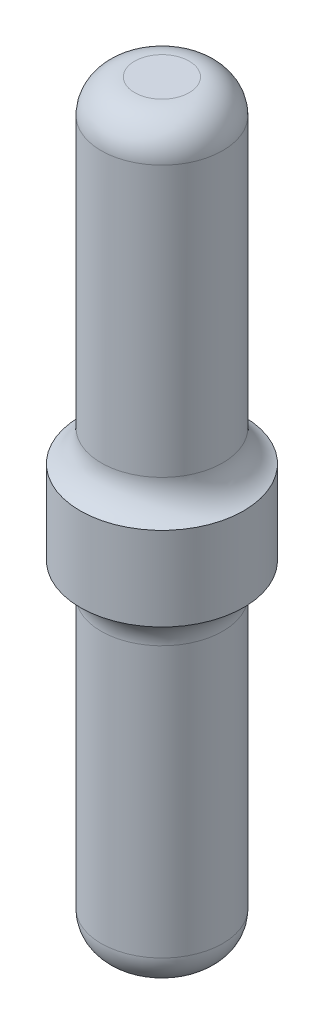
from build123d import *

# Parameters (mm, degrees)
CROQUIS1_R              = 2.44
SALIENTE_EXTRUIR1_DEPTH = 2.5
CROQUIS2_R              = 1.815
SALIENTE_EXTRUIR2_DEPTH = 10
SALIENTE_EXTRUIR3_START = 10
CROQUIS3_R              = 1.815
SALIENTE_EXTRUIR3_DEPTH = 10
REDONDEO1_R             = 1
REDONDEO2_R             = 1


with BuildPart() as part:
    # Croquis1 → Saliente-Extruir1 (new body)
    with BuildSketch(Plane(origin=(0, 0, 0), x_dir=(1, 0, 0), z_dir=(0, 1, 0))):
        with Locations(Location((0, 0, 0), (0, 0, 270))):
            Circle(CROQUIS1_R)
    extrude(amount=SALIENTE_EXTRUIR1_DEPTH)

    # Croquis2 → Saliente-Extruir2 (add)
    with BuildSketch(Plane(origin=(0, 2.5, 0), x_dir=(1, 0, 0), z_dir=(0, 1, 0))):
        with Locations(Location((0, 0, 0), (0, 0, 270))):
            Circle(CROQUIS2_R)
    extrude(amount=SALIENTE_EXTRUIR2_DEPTH)

    # Croquis3 → Saliente-Extruir3 (add)
    with BuildSketch(Plane.XZ.offset(SALIENTE_EXTRUIR3_START)):
        with Locations(Location((0, 0, 0), (0, 0, 90))):
            Circle(CROQUIS3_R)
    extrude(amount=-SALIENTE_EXTRUIR3_DEPTH)

    # Redondeo1
    # the kernel refuses this fillet: 1 mm, written as the material it adds along each edge
    with BuildSketch(Plane(origin=(0, 0, 0), x_dir=(0, 0, 1), z_dir=(1, 0, 0))) as redondeo1_piece_1:
        with BuildLine():
            CenterArc((2.815, 0.927024811), REDONDEO1_R, 180, 67.975687163)
            Line((1.815, 0.927024811), (1.795, 0.927024811))
            Line((1.795, 0.927024811), (1.795, 0))
            Line((1.795, 0), (1.815, -0.02))
            ThreePointArc((1.815, -0.02), (2.1275, -0.02), (2.4325, -0.018540496))
            Line((2.4325, -0.018540496), (2.44, 0))
        make_face()
    revolve(axis=Axis((0, 0, 0), (0, -1, 0)))
    with BuildSketch(Plane(origin=(0, 2.5, 0), x_dir=(0, 0, 1), z_dir=(-1, 0, 0))) as redondeo1_piece_2:
        with BuildLine():
            CenterArc((2.815, 0.927024811), REDONDEO1_R, 180, 67.975687163)
            Line((1.815, 0.927024811), (1.795, 0.927024811))
            Line((1.795, 0.927024811), (1.795, 0))
            Line((1.795, 0), (1.815, -0.02))
            ThreePointArc((1.815, -0.02), (2.1275, -0.02), (2.4325, -0.018540496))
            Line((2.4325, -0.018540496), (2.44, 0))
        make_face()
    revolve(axis=Axis((0, 2.5, 0), (0, 1, 0)))

    # Redondeo2
    redondeo2_edges = [part.edges().sort_by_distance(p)[0] for p in [
        (0, -10, -1.815),
        (0, 12.5, -1.815),
    ]]
    fillet(redondeo2_edges, radius=REDONDEO2_R)


solid = part.part
